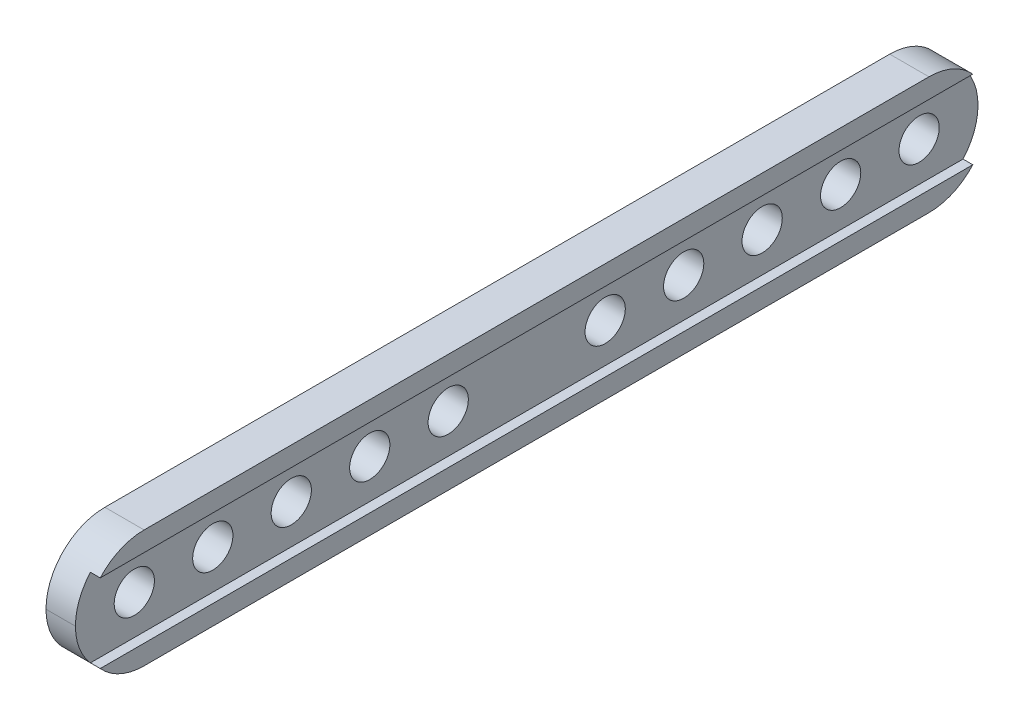
from build123d import *

# Parameters (mm, degrees)
BOSS_EXTRUDE1_DEPTH     = 92
FILLET1_R               = 6
SKETCH2_R               = 2.05
CUT_EXTRUDE1_DEPTH      = 93.86549413
LPATTERN1_COUNT         = 5
LPATTERN1_PITCH         = 8
MIRROR1_COPY_1_SKETCH_R = 2.05
MIRROR1_COPY_1_DEPTH    = 93.86549413
MIRROR1_COPY_2_SKETCH_R = 2.05
MIRROR1_COPY_2_DEPTH    = 93.86549413
MIRROR1_COPY_3_SKETCH_R = 2.05
MIRROR1_COPY_3_DEPTH    = 93.86549413
MIRROR1_COPY_4_SKETCH_R = 2.05
MIRROR1_COPY_4_DEPTH    = 93.86549413


with BuildPart() as part:
    # Sketch1 → Boss-Extrude1 (new body)
    with BuildSketch(Plane.XY):
        Polygon((0, 0), (4, 0), (4, 2), (3, 2), (3, 10), (4, 10), (4, 12), (0, 12), align=None)
    extrude(amount=-BOSS_EXTRUDE1_DEPTH)

    # Fillet1
    fillet1_edges = [part.edges().sort_by_distance(p)[0] for p in [
        (2, 12, 0),
        (2, 0, 0),
        (2, 0, -92),
        (2, 12, -92),
    ]]
    fillet(fillet1_edges, radius=FILLET1_R - 0.0001)  # a hair under: the kernel refuses the full size

    # Sketch2 → Cut-Extrude1 (cut, through all)
    with BuildSketch(Plane.ZY):
        with Locations(Location((-86, 6, 0), (0, 0, 270))):
            Circle(SKETCH2_R)
    cut_extrude1 = extrude(amount=-CUT_EXTRUDE1_DEPTH, mode=Mode.SUBTRACT)

    # LPattern1: Cut-Extrude1 ×5
    with Locations(*[(0, 0, i * LPATTERN1_PITCH) for i in range(1, LPATTERN1_COUNT)]):
        add(cut_extrude1, mode=Mode.SUBTRACT)

    # Mirror1: Cut-Extrude1 across plane
    add(cut_extrude1.mirror(Plane.XY.offset(-46)), mode=Mode.SUBTRACT)

    # Mirror1 copy 1 sketch → Mirror1 copy 1 (cut, through all)
    with BuildSketch(Plane(origin=(0, 0, -100), x_dir=(0, 0, -1), z_dir=(-1, 0, 0))):
        with Locations((-86, -6)):
            Circle(MIRROR1_COPY_1_SKETCH_R)
    extrude(amount=-MIRROR1_COPY_1_DEPTH, mode=Mode.SUBTRACT)

    # Mirror1 copy 2 sketch → Mirror1 copy 2 (cut, through all)
    with BuildSketch(Plane(origin=(0, 0, -108), x_dir=(0, 0, -1), z_dir=(-1, 0, 0))):
        with Locations((-86, -6)):
            Circle(MIRROR1_COPY_2_SKETCH_R)
    extrude(amount=-MIRROR1_COPY_2_DEPTH, mode=Mode.SUBTRACT)

    # Mirror1 copy 3 sketch → Mirror1 copy 3 (cut, through all)
    with BuildSketch(Plane(origin=(0, 0, -116), x_dir=(0, 0, -1), z_dir=(-1, 0, 0))):
        with Locations((-86, -6)):
            Circle(MIRROR1_COPY_3_SKETCH_R)
    extrude(amount=-MIRROR1_COPY_3_DEPTH, mode=Mode.SUBTRACT)

    # Mirror1 copy 4 sketch → Mirror1 copy 4 (cut, through all)
    with BuildSketch(Plane(origin=(0, 0, -124), x_dir=(0, 0, -1), z_dir=(-1, 0, 0))):
        with Locations((-86, -6)):
            Circle(MIRROR1_COPY_4_SKETCH_R)
    extrude(amount=-MIRROR1_COPY_4_DEPTH, mode=Mode.SUBTRACT)


solid = part.part
